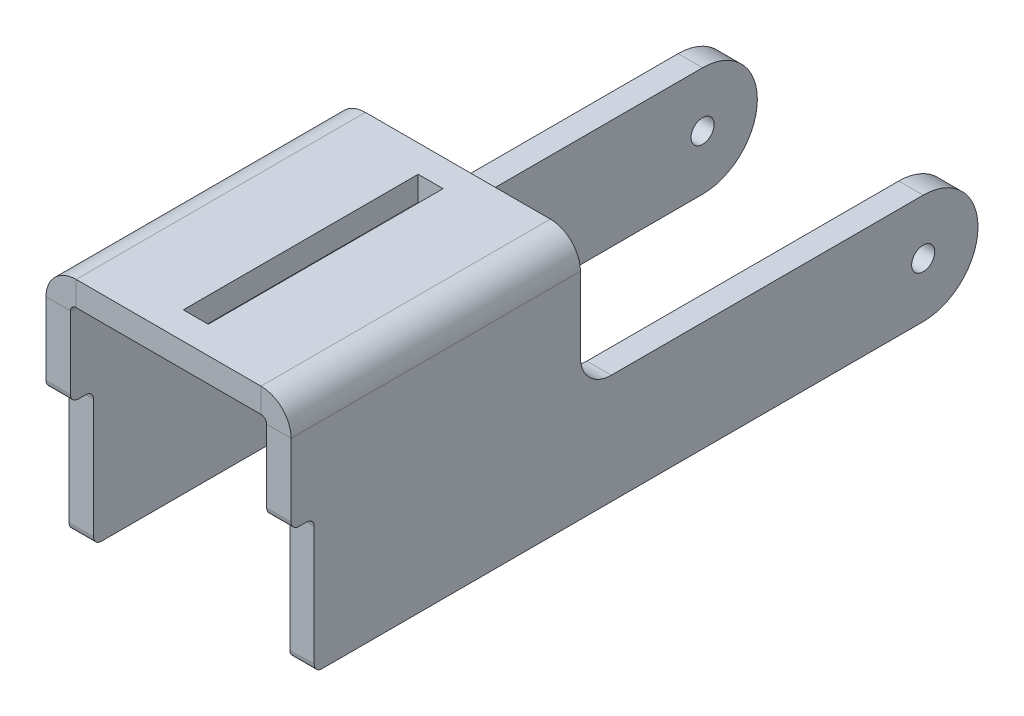
from build123d import *

# Parameters (mm, degrees)
BRIDA_BASE1_DEPTH          = 89.15
CORTAR_EXTRUIR3_DEPTH      = 100.859660931
CORTAR_EXTRUIR3_DEPTH_BACK = 100.859660931
CROQUIS7_W                 = 3
CROQUIS7_H                 = 17.495
REDONDEO6_R                = 1
REDONDEO8_RADIUS           = 7.11
REDONDEO8_LENGTH           = 3.175
REDONDEO9_RADIUS           = 7.11
REDONDEO9_LENGTH           = 3.175
CORTAR_EXTRUIR4_DEPTH      = 100.859660931
CORTAR_EXTRUIR4_DEPTH_BACK = 100.859660931
CROQUIS14_R                = 1.5
CORTAR_EXTRUIR5_DEPTH      = 99.89399947
CORTAR_EXTRUIR5_DEPTH_BACK = 99.89399947
CROQUIS15_W                = 3.24
CROQUIS15_H                = 30.48


# Sheet-metal steps are written as plain solids
with BuildPart() as part:
    # Croquis1 → Brida base1 (new body)
    with BuildSketch(Plane.XY):
        with BuildLine():
            Line((25.4625, 0), (25.4625, 27.9034))
            ThreePointArc((25.4625, 27.9034), (25.246754855, 28.424254855), (24.7259, 28.64))
            Line((24.7259, 28.64), (0.7366, 28.64))
            ThreePointArc((0.7366, 28.64), (0.215745145, 28.424254855), (0, 27.9034))
            Line((0, 27.9034), (0, 0))
            Line((0, 0), (-3.175, 0))
            Line((-3.175, 0), (-3.175, 27.9034))
            ThreePointArc((-3.175, 27.9034), (-2.029318885, 30.669318885), (0.7366, 31.815))
            Line((0.7366, 31.815), (24.7259, 31.815))
            ThreePointArc((24.7259, 31.815), (27.491818885, 30.669318885), (28.6375, 27.9034))
            Line((28.6375, 27.9034), (28.6375, 0))
            Line((28.6375, 0), (25.4625, 0))
        make_face()
    extrude(amount=BRIDA_BASE1_DEPTH)

    # Croquis7 → Cortar-Extruir3 (cut, two sides: drawn at the far end of the back side and taken through both)
    with BuildSketch(Plane(origin=(28.6375, 0, 0), x_dir=(0, 0, -1), z_dir=(1, 0, 0)).offset(-CORTAR_EXTRUIR3_DEPTH_BACK)):
        with BuildLine():
            Line((0, 31.815), (-51.6, 31.815))
            Line((-51.6, 31.815), (-51.6, 18.22))
            ThreePointArc((-51.6, 18.22), (-50.428427125, 15.391572875), (-47.6, 14.22))
            Line((-47.6, 14.22), (0, 14.22))
            Line((0, 14.22), (0, 31.815))
        make_face()
        with Locations((-87.65, 8.7475)):
            Rectangle(CROQUIS7_W, CROQUIS7_H)
    extrude(amount=CORTAR_EXTRUIR3_DEPTH + CORTAR_EXTRUIR3_DEPTH_BACK, mode=Mode.SUBTRACT)

    # Redondeo6
    redondeo6_edges = [part.edges().sort_by_distance(p)[0] for p in [
        (-1.5875, 17.495, 86.15),
        (-1.5875, 17.495, 89.15),
        (-1.5875, 0, 86.15),
        (27.05, 17.495, 86.15),
        (27.05, 0, 86.15),
        (27.05, 17.495, 89.15),
    ]]
    fillet(redondeo6_edges, radius=REDONDEO6_R)

    # Redondeo8: full round fillet: the end face becomes a half cylinder, R = half its width
    redondeo8_face = Plane((27.05, 7.11, 0), x_dir=(-1, 0, 0), z_dir=(0, 0, -1))  # on the end face: x along it, z out of the body
    redondeo8_slab = redondeo8_face.offset(-REDONDEO8_RADIUS / 2) * Box(REDONDEO8_LENGTH, 2 * REDONDEO8_RADIUS, REDONDEO8_RADIUS, mode=Mode.PRIVATE)  # the body's end, R deep
    redondeo8_round = Plane((27.05, 7.11, 7.11), x_dir=(0, 0, -1), z_dir=(-1, 0, 0)) * Cylinder(REDONDEO8_RADIUS, REDONDEO8_LENGTH, mode=Mode.PRIVATE)  # its axis R under the face
    add(redondeo8_slab - redondeo8_round, mode=Mode.SUBTRACT)

    # Redondeo9: full round fillet: the end face becomes a half cylinder, R = half its width
    redondeo9_face = Plane((-1.5875, 7.11, 0), x_dir=(-1, 0, 0), z_dir=(0, 0, -1))  # on the end face: x along it, z out of the body
    redondeo9_slab = redondeo9_face.offset(-REDONDEO9_RADIUS / 2) * Box(REDONDEO9_LENGTH, 2 * REDONDEO9_RADIUS, REDONDEO9_RADIUS, mode=Mode.PRIVATE)  # the body's end, R deep
    redondeo9_round = Plane((-1.5875, 7.11, 7.11), x_dir=(0, 0, -1), z_dir=(-1, 0, 0)) * Cylinder(REDONDEO9_RADIUS, REDONDEO9_LENGTH, mode=Mode.PRIVATE)  # its axis R under the face
    add(redondeo9_slab - redondeo9_round, mode=Mode.SUBTRACT)

    # Croquis14 → Cortar-Extruir4 (cut, two sides: drawn at the far end of the back side and taken through both)
    with BuildSketch(Plane(origin=(28.6375, 0, 0), x_dir=(0, 0, -1), z_dir=(1, 0, 0)).offset(-CORTAR_EXTRUIR4_DEPTH_BACK)):
        with Locations((-7.11, 7.11)):
            Circle(CROQUIS14_R)
    extrude(amount=CORTAR_EXTRUIR4_DEPTH + CORTAR_EXTRUIR4_DEPTH_BACK, mode=Mode.SUBTRACT)

    # Croquis15 → Cortar-Extruir5 (cut, two sides: drawn at the far end of the back side and taken through both)
    with BuildSketch(Plane(origin=(0, 31.815, 0), x_dir=(1, 0, 0), z_dir=(0, 1, 0)).offset(-CORTAR_EXTRUIR5_DEPTH_BACK)):
        with Locations((12.73125, -70.375)):
            Rectangle(CROQUIS15_W, CROQUIS15_H)
    extrude(amount=CORTAR_EXTRUIR5_DEPTH + CORTAR_EXTRUIR5_DEPTH_BACK, mode=Mode.SUBTRACT)


solid = part.part
